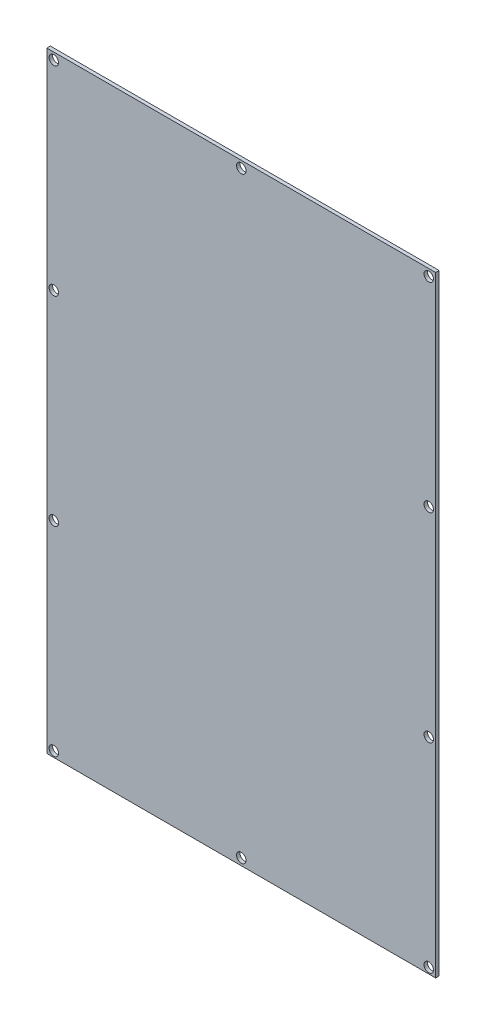
from build123d import *

# Parameters (mm, degrees)
SKETCH1_W           = 177.8
SKETCH1_H           = 279.4
BOSS_EXTRUDE1_DEPTH = 1.5875
SKETCH2_R           = 2.159
CUT_EXTRUDE1_DEPTH  = 332.179287028


with BuildPart() as part:
    # Sketch1 → Boss-Extrude1 (new body)
    with BuildSketch(Plane.XY):
        with Locations((88.9, 139.7)):
            Rectangle(SKETCH1_W, SKETCH1_H)
    extrude(amount=BOSS_EXTRUDE1_DEPTH)

    # Sketch2 → Cut-Extrude1 (cut, through all)
    with BuildSketch(Plane.XY.offset(1.5875)):
        with Locations((3.175, 276.225)):
            Circle(SKETCH2_R)
        with Locations((88.9, 276.225)):
            Circle(SKETCH2_R)
        with Locations((174.625, 276.225)):
            Circle(SKETCH2_R)
        with Locations((3.175, 185.039)):
            Circle(SKETCH2_R)
        with Locations((174.625, 185.039)):
            Circle(SKETCH2_R)
        with Locations((3.175, 93.853)):
            Circle(SKETCH2_R)
        with Locations((174.625, 93.853)):
            Circle(SKETCH2_R)
        with Locations((3.175, 2.667)):
            Circle(SKETCH2_R)
        with Locations((174.625, 2.667)):
            Circle(SKETCH2_R)
        with Locations((88.9, 3.175)):
            Circle(SKETCH2_R)
    extrude(amount=-CUT_EXTRUDE1_DEPTH, mode=Mode.SUBTRACT)


solid = part.part
